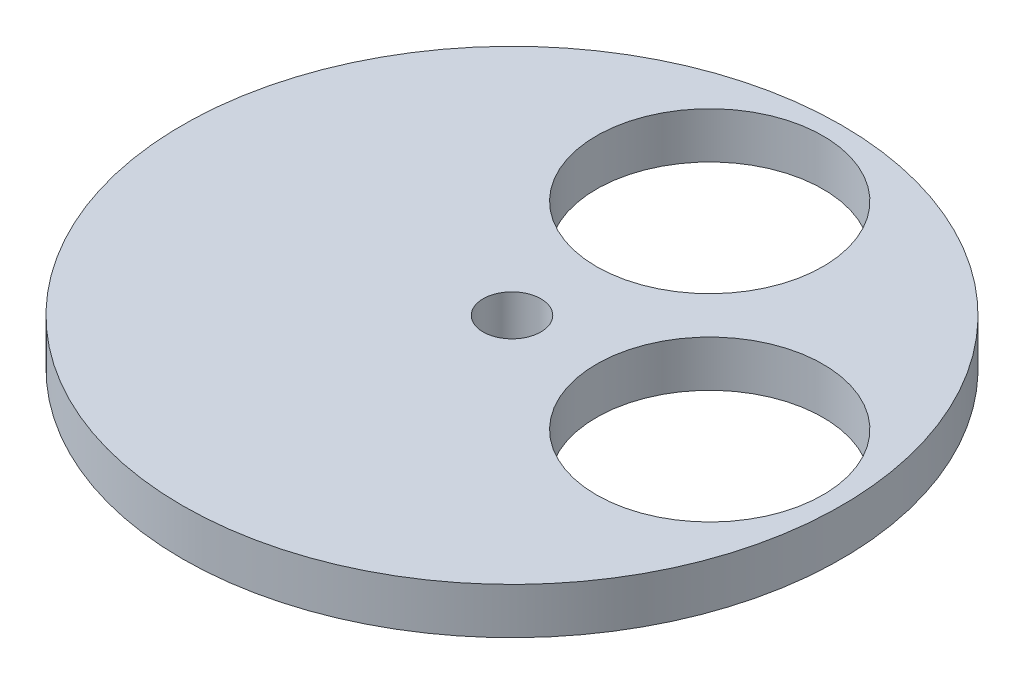
from build123d import *

# Parameters (mm, degrees)
SKETCH6_R           = 50.8
BOSS_EXTRUDE3_DEPTH = 7.112
SKETCH11_R          = 17.4625
CUT_EXTRUDE2_DEPTH  = 162.800990553
SKETCH12_R          = 4.445
CUT_EXTRUDE3_DEPTH  = 162.800990553


with BuildPart() as part:
    # Sketch6 → Boss-Extrude3 (new body)
    with BuildSketch(Plane(origin=(0, 0, 0), x_dir=(1, 0, 0), z_dir=(0, 1, 0))):
        with Locations((63.5, 63.5)):
            Circle(SKETCH6_R)
    extrude(amount=BOSS_EXTRUDE3_DEPTH)

    # Sketch11 → Cut-Extrude2 (cut, through all)
    with BuildSketch(Plane(origin=(0, 7.112, 0), x_dir=(1, 0, 0), z_dir=(0, 1, 0))):
        with Locations((63.5, 93.98)):
            Circle(SKETCH11_R)
        with Locations((93.98, 63.5)):
            Circle(SKETCH11_R)
    extrude(amount=-CUT_EXTRUDE2_DEPTH, mode=Mode.SUBTRACT)

    # Sketch12 → Cut-Extrude3 (cut, through all)
    with BuildSketch(Plane(origin=(0, 7.112, 0), x_dir=(1, 0, 0), z_dir=(0, 1, 0))):
        with Locations((63.5, 63.5)):
            Circle(SKETCH12_R)
    extrude(amount=-CUT_EXTRUDE3_DEPTH, mode=Mode.SUBTRACT)


solid = part.part
